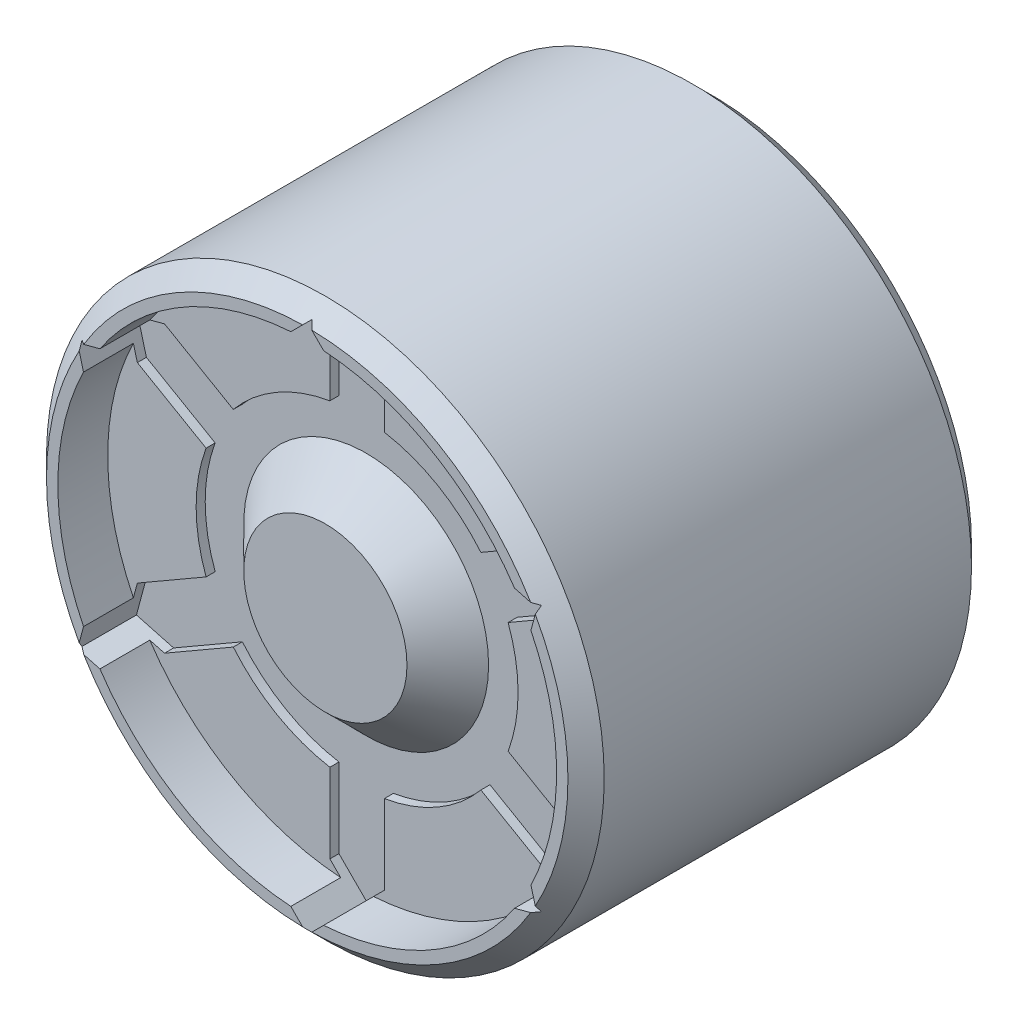
from build123d import *

# Parameters (mm, degrees)
SKETCH_1_R          = 6.15
EXTRUDE_1_DEPTH     = 0.2
SKETCH_2_R          = 2.8
EXTRUDE_2_DEPTH     = 0.9
SKETCH_3_R          = 6.15
EXTRUDE_3_DEPTH     = 1.1
EXTRUDE_START       = -0.6
SKETCH_4_R          = 6.15
EXTRUDE_4_DEPTH     = 0.6
CUT_EXTRUDE_START   = -0.2
SKETCH_6_R          = 3.55
SKETCH_6_R_2        = 2.8
CUT_EXTRUDE_2_DEPTH = 0.2
EXTRUDE_START_2     = 7
SKETCH_7_R          = 6.15
SKETCH_7_R_2        = 4.75
EXTRUDE_5_DEPTH     = 7
CHAMFER_4_SIZE      = 2.5
CHAMFER_5_SIZE      = 0.4
CHAMFER_6_SIZE      = 0.4
CHAMFER_7_SIZE      = 1
CHAMFER_8_SIZE      = 0.3


with BuildPart() as part:
    # 스케치1 → 보스-돌출1 (new body)
    with BuildSketch(Plane.XY):
        Circle(SKETCH_1_R)
        with BuildLine():
            Line((-0.6, 5.25), (0, 5.85))
            Line((0, 5.85), (0.6, 5.25))
            Line((0.6, 5.25), (0.6, 1.670516387))
            ThreePointArc((0.6, 1.670516387), (0.8875, 1.537195092), (1.146709629, 1.354873436))
            Line((1.146709629, 1.354873436), (4.24663337, 3.144615242))
            Line((4.24663337, 3.144615242), (5.066248612, 2.925))
            Line((5.066248612, 2.925), (4.84663337, 2.105384758))
            Line((4.84663337, 2.105384758), (1.746709629, 0.315642951))
            ThreePointArc((1.746709629, 0.315642951), (1.76791326, 0.158454108), (1.775, 0))
            ThreePointArc((1.775, 0), (1.76791326, -0.158454108), (1.746709629, -0.315642951))
            Line((1.746709629, -0.315642951), (4.84663337, -2.105384758))
            Line((4.84663337, -2.105384758), (5.066248612, -2.925))
            Line((5.066248612, -2.925), (4.24663337, -3.144615242))
            Line((4.24663337, -3.144615242), (1.146709629, -1.354873436))
            ThreePointArc((1.146709629, -1.354873436), (0.8875, -1.537195092), (0.6, -1.670516387))
            Line((0.6, -1.670516387), (0.6, -5.25))
            Line((0.6, -5.25), (0, -5.85))
            Line((0, -5.85), (-0.6, -5.25))
            Line((-0.6, -5.25), (-0.6, -1.670516387))
            ThreePointArc((-0.6, -1.670516387), (-0.8875, -1.537195092), (-1.146709629, -1.354873436))
            Line((-1.146709629, -1.354873436), (-4.24663337, -3.144615242))
            Line((-4.24663337, -3.144615242), (-5.066248612, -2.925))
            Line((-5.066248612, -2.925), (-4.84663337, -2.105384758))
            Line((-4.84663337, -2.105384758), (-1.746709629, -0.315642951))
            ThreePointArc((-1.746709629, -0.315642951), (-1.775, 0), (-1.746709629, 0.315642951))
            Line((-1.746709629, 0.315642951), (-4.84663337, 2.105384758))
            Line((-4.84663337, 2.105384758), (-5.066248612, 2.925))
            Line((-5.066248612, 2.925), (-4.24663337, 3.144615242))
            Line((-4.24663337, 3.144615242), (-1.146709629, 1.354873436))
            ThreePointArc((-1.146709629, 1.354873436), (-0.8875, 1.537195092), (-0.6, 1.670516387))
            Line((-0.6, 1.670516387), (-0.6, 5.25))
        make_face(mode=Mode.SUBTRACT)
    extrude(amount=EXTRUDE_1_DEPTH)

    # 스케치3 → 보스-돌출3 (add)
    with BuildSketch(Plane.XY.offset(0.2)):
        Circle(SKETCH_3_R)
        with BuildLine():
            Line((-4.933776406, -2.430606997), (-5.066248612, -2.925))
            Line((-5.066248612, -2.925), (-4.571855609, -3.057472206))
            ThreePointArc((-4.571855609, -3.057472206), (-2.75, -4.763139721), (-0.361920797, -5.488079203))
            Line((-0.361920797, -5.488079203), (0, -5.85))
            Line((0, -5.85), (0.361920797, -5.488079203))
            ThreePointArc((0.361920797, -5.488079203), (2.75, -4.763139721), (4.571855609, -3.057472206))
            Line((4.571855609, -3.057472206), (5.066248612, -2.925))
            Line((5.066248612, -2.925), (4.933776406, -2.430606997))
            ThreePointArc((4.933776406, -2.430606997), (5.5, 0), (4.933776406, 2.430606997))
            Line((4.933776406, 2.430606997), (5.066248612, 2.925))
            Line((5.066248612, 2.925), (4.571855609, 3.057472206))
            ThreePointArc((4.571855609, 3.057472206), (2.75, 4.763139721), (0.361920797, 5.488079203))
            Line((0.361920797, 5.488079203), (0, 5.85))
            Line((0, 5.85), (-0.361920797, 5.488079203))
            ThreePointArc((-0.361920797, 5.488079203), (-2.75, 4.763139721), (-4.571855609, 3.057472206))
            Line((-4.571855609, 3.057472206), (-5.066248612, 2.925))
            Line((-5.066248612, 2.925), (-4.933776406, 2.430606997))
            ThreePointArc((-4.933776406, 2.430606997), (-5.5, 0), (-4.933776406, -2.430606997))
        make_face(mode=Mode.SUBTRACT)
    extrude(amount=EXTRUDE_3_DEPTH)



with BuildPart() as body_2:
    # 스케치2 → 보스-돌출2 (new body)
    with BuildSketch(Plane.XY):
        Circle(SKETCH_2_R)
    extrude(amount=EXTRUDE_2_DEPTH)


with BuildPart() as part_1:
    add(part.part)

    add(body_2.part)  # 보스-돌출4 merges body 2
    # 스케치4 → 보스-돌출4 (add)
    with BuildSketch(Plane.XY.offset(EXTRUDE_START)):
        Circle(SKETCH_4_R)
    extrude(amount=EXTRUDE_4_DEPTH)

    # 스케치6 → 컷-돌출2 (cut)
    with BuildSketch(Plane.XY.offset(0.2).offset(CUT_EXTRUDE_START)):
        Circle(SKETCH_6_R)
        Circle(SKETCH_6_R_2, mode=Mode.SUBTRACT)
    extrude(amount=CUT_EXTRUDE_2_DEPTH, mode=Mode.SUBTRACT)

    # 스케치7 → 보스-돌출5 (add)
    with BuildSketch(Plane(origin=(0, 0, -0.6), x_dir=(-1, 0, 0), z_dir=(0, 0, -1)).offset(EXTRUDE_START_2)):
        with Locations(Location((0, 0, 0), (0, 0, 180))):
            Circle(SKETCH_7_R)
        Circle(SKETCH_7_R_2, mode=Mode.SUBTRACT)
    extrude(amount=-EXTRUDE_5_DEPTH)

    # 모따기4
    chamfer_4_edges = [part_1.edges().sort_by_distance(p)[0] for p in [
        (4.75, 0, -0.6),
    ]]
    chamfer(chamfer_4_edges, length=CHAMFER_4_SIZE)

    # 모따기5
    # the kernel refuses this chamfer: 0.4 mm, written as the material it takes off along each edge
    with BuildSketch(Plane(origin=(0, 0, 1.3), x_dir=(1, 0, 0), z_dir=(0, -1, 0))) as chamfer_5_piece_1:
        Polygon((6.15, -CHAMFER_5_SIZE), (6.15 - CHAMFER_5_SIZE, 0), (6.15, 0), align=None)
    revolve(axis=Axis((0, 0, 1.3), (0, 0, 1)), mode=Mode.SUBTRACT)

    # 모따기6
    chamfer_6_edges = [part_1.edges().sort_by_distance(p)[0] for p in [
        (-6.15, 0, -7.6),
    ]]
    chamfer(chamfer_6_edges, length=CHAMFER_6_SIZE)

    # 모따기7
    # the kernel refuses this chamfer: 1 mm, written as the material it takes off along each edge
    with BuildSketch(Plane(origin=(0, 0, 0.9), x_dir=(1, 0, 0), z_dir=(0, -1, 0))) as chamfer_7_piece_1_section:
        Polygon((2.8, -CHAMFER_7_SIZE), (2.8 - CHAMFER_7_SIZE, 0), (2.8, 0), align=None)
    chamfer_7_piece_1 = revolve(axis=Axis((0, 0, 0.9), (0, 0, 1)), mode=Mode.PRIVATE)
    chamfer_7_piece_1 = split(chamfer_7_piece_1, bisect_by=Plane(origin=(-2.250209939, 0, 0), z_dir=(0, 0, 1)), keep=Keep.TOP, mode=Mode.PRIVATE)
    add(chamfer_7_piece_1, mode=Mode.SUBTRACT)

    # 모따기8
    chamfer_8_edges = [part_1.edges().sort_by_distance(p)[0] for p in [
        (4.75, 0, -7.6),
    ]]
    chamfer(chamfer_8_edges, length=CHAMFER_8_SIZE)


solid = part_1.part
